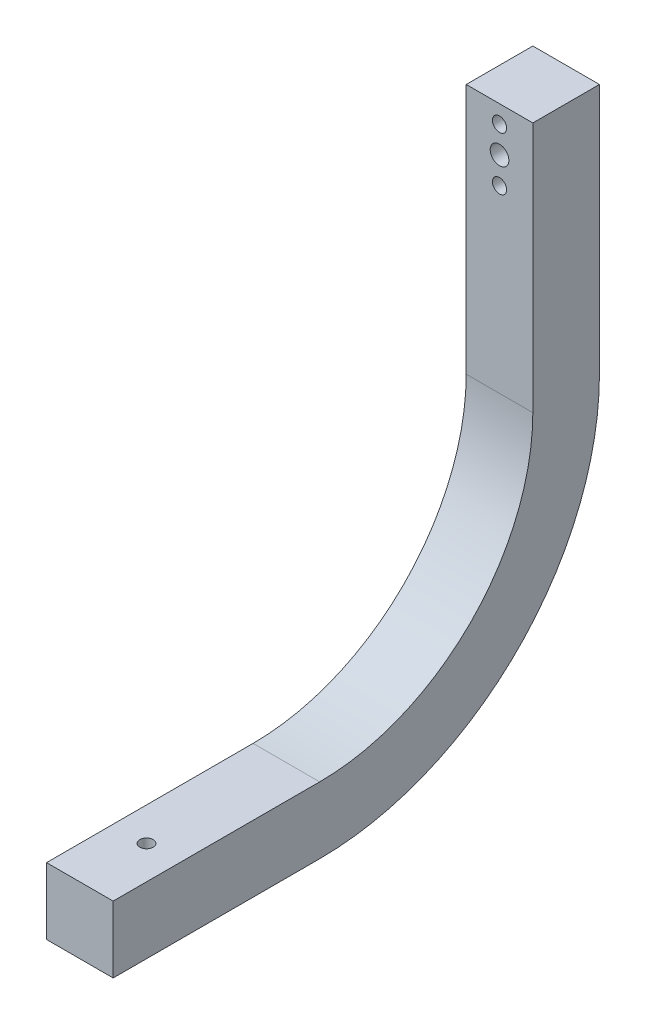
from build123d import *

# Parameters (mm, degrees)
BOSS_EXTRUDE1_DEPTH      = 7.5
BOSS_EXTRUDE1_DEPTH_BACK = 7.5
SKETCH3_R                = 1.5
CUT_EXTRUDE1_DEPTH       = 152.54784723
CUT_EXTRUDE2_DEPTH       = 145.833525125
CUT_EXTRUDE2_DEPTH_BACK  = 145.833525125
SKETCH4_R                = 2.1
SKETCH4_R_2              = 1.6
SKETCH5_R                = 2.275
CUT_EXTRUDE3_DEPTH       = 6
SKETCH6_R                = 3.825
CUT_EXTRUDE4_DEPTH       = 0.75


with BuildPart() as part:
    # Sketch1 → Boss-Extrude1 (new, two sides: drawn at the far end of the back side and taken through both)
    with BuildSketch(Plane(origin=(0, 0, 0), x_dir=(0, 0, -1), z_dir=(1, 0, 0)).offset(-BOSS_EXTRUDE1_DEPTH_BACK)):
        with BuildLine():
            Line((-15, 10), (0, 10))
            Line((0, 10), (0, -46.5))
            ThreePointArc((0, -46.5), (-18.452272785, -91.047727215), (-63, -109.5))
            Line((-63, -109.5), (-94.5, -109.5))
            Line((-94.5, -109.5), (-109.5, -109.5))
            Line((-109.5, -109.5), (-109.5, -94.5))
            Line((-109.5, -94.5), (-94.5, -94.5))
            Line((-94.5, -94.5), (-63, -94.5))
            ThreePointArc((-63, -94.5), (-29.058874503, -80.441125497), (-15, -46.5))
            Line((-15, -46.5), (-15, 10))
        make_face()
    extrude(amount=BOSS_EXTRUDE1_DEPTH + BOSS_EXTRUDE1_DEPTH_BACK)

    # Sketch3 → Cut-Extrude1 (cut, through all)
    with BuildSketch(Plane(origin=(0, -94.5, 0), x_dir=(1, 0, 0), z_dir=(0, 1, 0))):
        with Locations((0, -94.5)):
            Circle(SKETCH3_R)
    extrude(amount=-CUT_EXTRUDE1_DEPTH, mode=Mode.SUBTRACT)

    # Sketch4 → Cut-Extrude2 (cut, two sides: drawn at the far end of the back side and taken through both)
    with BuildSketch(Plane.XY.offset(15).offset(-CUT_EXTRUDE2_DEPTH_BACK)):
        Circle(SKETCH4_R)
        with Locations((0, 6)):
            Circle(SKETCH4_R_2)
        with Locations((0, -6)):
            Circle(SKETCH4_R_2)
    extrude(amount=CUT_EXTRUDE2_DEPTH + CUT_EXTRUDE2_DEPTH_BACK, mode=Mode.SUBTRACT)

    # Sketch5 → Cut-Extrude3 (cut)
    with BuildSketch(Plane.XZ.offset(109.5)):
        with Locations((0, 94.5)):
            Circle(SKETCH5_R)
    extrude(amount=-CUT_EXTRUDE3_DEPTH, mode=Mode.SUBTRACT)

    # Sketch6 → Cut-Extrude4 (cut)
    with BuildSketch(Plane.XZ.offset(109.5)):
        with Locations((0, 94.5)):
            Circle(SKETCH6_R)
    extrude(amount=-CUT_EXTRUDE4_DEPTH, mode=Mode.SUBTRACT)


solid = part.part
